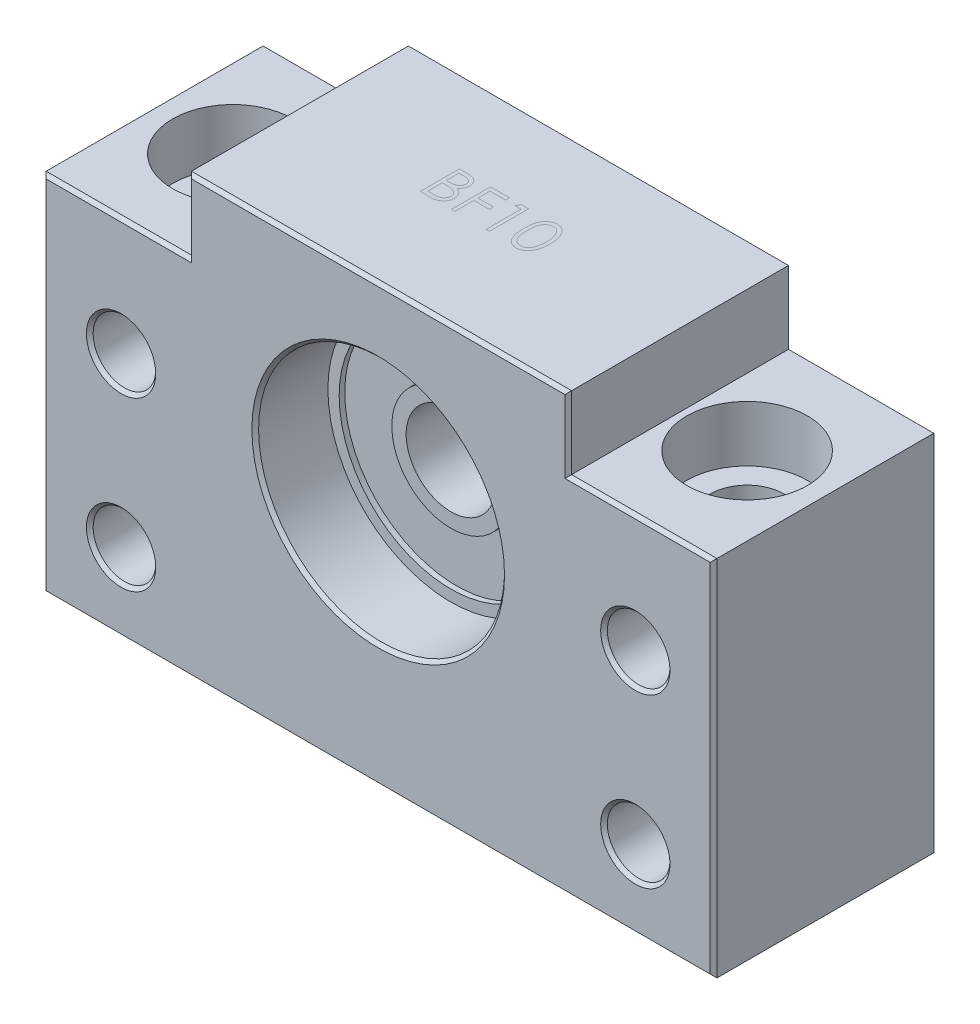
from build123d import *

# Parameters (mm, degrees)
SKETCH1_R                  = 2.8
BOSS_EXTRUDE1_DEPTH        = 20
F_22_0_22_DIAMETER_HOLE1_D = 22
SKETCH10_R                 = 3.3
CUT_EXTRUDE3_DEPTH         = 46.345892868
SKETCH11_R                 = 5.4
CUT_EXTRUDE4_DEPTH         = 5
CHAMFER3_SIZE              = 0.3


with BuildPart() as part:
    # Sketch1 → Boss-Extrude1 (new body)
    with BuildSketch(Plane(origin=(0, 0, -10), x_dir=(-1, 0, 0), z_dir=(0, 0, -1))):
        Polygon((-30, -0.121488027), (30, -0.121488027), (30, 32.378511973), (17, 32.378511973), (17, 38.878511973), (-17, 38.878511973), (-17, 32.378511973), (-30, 32.378511973), align=None)
        with Locations((-23, 21.898511973)):
            Circle(SKETCH1_R, mode=Mode.SUBTRACT)
        with Locations((23, 21.898511973)):
            Circle(SKETCH1_R, mode=Mode.SUBTRACT)
        with Locations((23, 6.898511973)):
            Circle(SKETCH1_R, mode=Mode.SUBTRACT)
        with Locations((-23, 6.898511973)):
            Circle(SKETCH1_R, mode=Mode.SUBTRACT)
    extrude(amount=-BOSS_EXTRUDE1_DEPTH)

    # Ø22.0 (22) Diameter Hole1 (through all)
    with Locations(Plane(origin=(0, 0, -10), x_dir=(-1, 0, 0), z_dir=(0, 0, -1))):
        with Locations((0, 21.898511973)):
            Hole(F_22_0_22_DIAMETER_HOLE1_D / 2)

    # Sketch10 → Cut-Extrude3 (cut, through all)
    with BuildSketch(Plane(origin=(0, 32.378511973, 0), x_dir=(1, 0, 0), z_dir=(0, 1, 0))):
        with Locations((-23, 0)):
            Circle(SKETCH10_R)
        with Locations((23, 0)):
            Circle(SKETCH10_R)
    extrude(amount=-CUT_EXTRUDE3_DEPTH, mode=Mode.SUBTRACT)

    # Sketch11 → Cut-Extrude4 (cut)
    with BuildSketch(Plane(origin=(0, 32.378511973, 0), x_dir=(1, 0, 0), z_dir=(0, 1, 0))):
        with Locations((-23, 0)):
            Circle(SKETCH11_R)
        with Locations((23, 0)):
            Circle(SKETCH11_R)
    extrude(amount=-CUT_EXTRUDE4_DEPTH, mode=Mode.SUBTRACT)

    # Sketch12 → Revolve1 (revolve)
    with BuildSketch(Plane(origin=(0, 0, 0), x_dir=(0, 0, -1), z_dir=(1, 0, 0))):
        Polygon((-3.5, 32.898511973), (3.5, 32.898511973), (3.5, 31.85598364), (3, 31.85598364), (3, 27.183941168), (3.5, 27.183941168), (3.5, 25.898511973), (-3.5, 25.898511973), (-3.5, 27.183941168), (-3, 27.183941168), (-3, 31.891721607), (-3.5, 31.891721607), align=None)
    revolve(axis=Axis((0, 21.898511973, 12.190434014), (0, 0, -1)))

    # Chamfer3
    chamfer3_edges = [part.edges().sort_by_distance(p)[0] for p in [
        (0, -0.121488027, -10),
        (30, 16.128511973, -10),
        (23.5, 32.378511973, -10),
        (17, 35.628511973, -10),
        (0, 38.878511973, -10),
        (-17, 35.628511973, -10),
        (-23.5, 32.378511973, -10),
        (-30, 16.128511973, -10),
        (25.8, 21.898511973, -10),
        (-20.2, 21.898511973, -10),
        (-20.2, 6.898511973, -10),
        (25.8, 6.898511973, -10),
        (-11, 21.898511973, -10),
        (-23.5, 32.378511973, 10),
        (-17, 35.628511973, 10),
        (0, 38.878511973, 10),
        (17, 35.628511973, 10),
        (23.5, 32.378511973, 10),
        (30, 16.128511973, 10),
        (0, -0.121488027, 10),
        (-30, 16.128511973, 10),
        (25.8, 21.898511973, 10),
        (-20.2, 21.898511973, 10),
        (-20.2, 6.898511973, 10),
        (25.8, 6.898511973, 10),
        (-11, 21.898511973, 10),
    ]]
    chamfer(chamfer3_edges, length=CHAMFER3_SIZE)


solid = part.part
